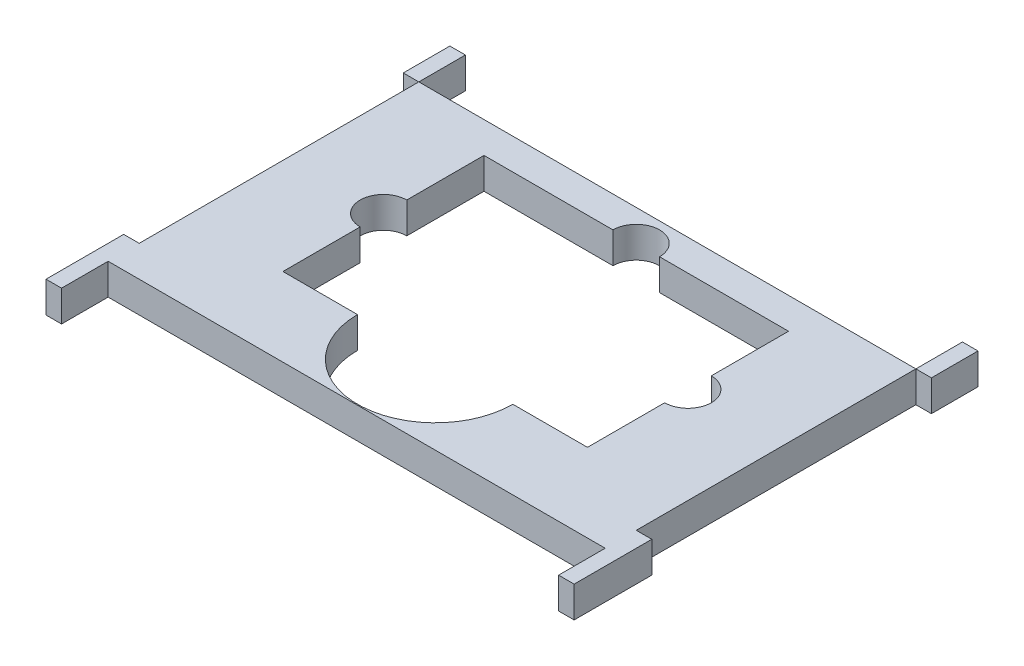
from build123d import *

# Parameters (mm, degrees)
SKETCH7_W           = 203.2
SKETCH7_H           = 127
SKETCH7_W_2         = 124.5
SKETCH7_H_2         = 82.199999938
BOSS_EXTRUDE4_DEPTH = 12.7
SKETCH9_W           = 6.35
SKETCH9_H           = 19.05
SKETCH9_H_2         = 31.75
BOSS_EXTRUDE6_DEPTH = 12.7
SKETCH10_R          = 9.525
SKETCH10_R_2        = 31.75
CUT_EXTRUDE1_DEPTH  = 137.488076402


with BuildPart() as part:
    # Sketch7 → Boss-Extrude4 (new body)
    with BuildSketch(Plane(origin=(0, 0, 0), x_dir=(1, 0, 0), z_dir=(0, 1, 0))):
        Rectangle(SKETCH7_W, SKETCH7_H)
        with Locations((0, 9.700000031)):
            Rectangle(SKETCH7_W_2, SKETCH7_H_2, mode=Mode.SUBTRACT)
    extrude(amount=BOSS_EXTRUDE4_DEPTH)

    # Sketch9 → Boss-Extrude6 (add)
    with BuildSketch(Plane(origin=(0, 0, 0), x_dir=(1, 0, 0), z_dir=(0, 1, 0))):
        with Locations((-104.775, 73.025)):
            Rectangle(SKETCH9_W, SKETCH9_H)
        with Locations((-104.775, -66.675)):
            Rectangle(SKETCH9_W, SKETCH9_H_2)
        with Locations((104.775, -66.675)):
            Rectangle(SKETCH9_W, SKETCH9_H_2)
        with Locations((104.775, 73.025)):
            Rectangle(SKETCH9_W, SKETCH9_H)
    extrude(amount=BOSS_EXTRUDE6_DEPTH)


with BuildPart() as boss_extrude6_piece_1:
    # of the separate pieces the step leaves, piece 1, a body of its own (boss_extrude6_pieces)
    add(part.part.solids().sort_by_distance((101.6, 0, 50.8))[0])

    # Sketch10 → Cut-Extrude1 (cut, through all)
    with BuildSketch(Plane(origin=(0, 12.7, 0), x_dir=(1, 0, 0), z_dir=(0, 1, 0))):
        with Locations((0, 50.8)):
            Circle(SKETCH10_R)
        with Locations((-62.25, 9.700000031)):
            Circle(SKETCH10_R)
        with Locations((0, -31.399999938)):
            Circle(SKETCH10_R_2)
        with Locations((62.25, 9.700000031)):
            Circle(SKETCH10_R)
    extrude(amount=-CUT_EXTRUDE1_DEPTH, mode=Mode.SUBTRACT)


with BuildPart() as boss_extrude6_piece_2:
    # of the separate pieces the step leaves, piece 2, a body of its own (boss_extrude6_pieces)
    add(part.part.solids().sort_by_distance((-101.6, 0, -82.55))[0])


with BuildPart() as boss_extrude6_piece_3:
    # of the separate pieces the step leaves, piece 3, a body of its own (boss_extrude6_pieces)
    add(part.part.solids().sort_by_distance((107.95, 0, -63.5))[0])


solid = Compound([boss_extrude6_piece_1.part, boss_extrude6_piece_2.part, boss_extrude6_piece_3.part])
